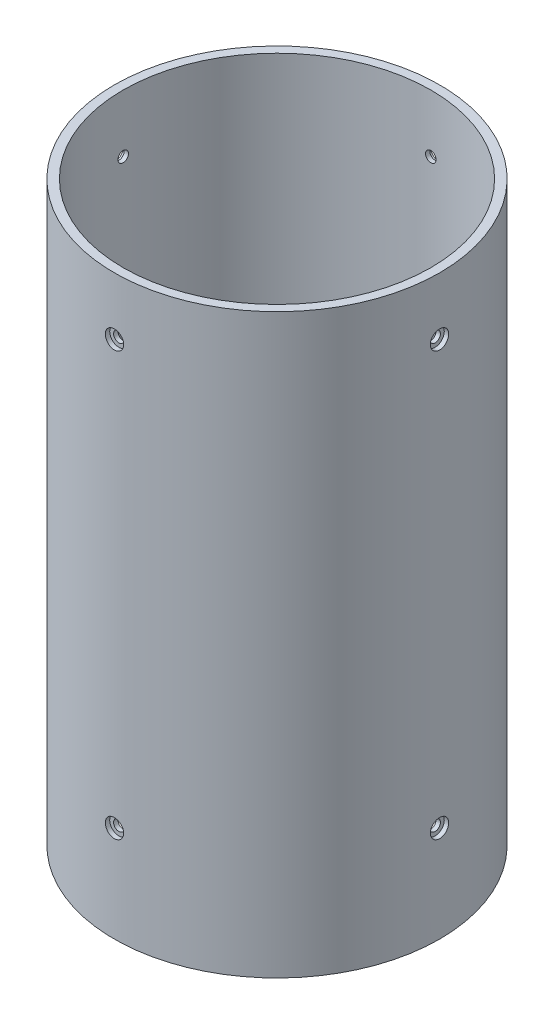
from build123d import *

# Parameters (mm, degrees)
SKETCH1_R                         = 53.721
SKETCH1_R_2                       = 50.8
BODY_EXTRUSION_DEPTH              = 190.5
UPPER_BULKHEAD_HOLES_REACH        = 227.211
SKETCH2_R                         = 1.7526
UPPER_BULKHEAD_HOLE_PATTERN_COUNT = 4
CUT_EXTRUDE1_REACH                = 227.211
SKETCH3_R                         = 1.7526
CIRPATTERN1_COUNT                 = 4
SKETCH4_R                         = 3.0226
COUNTERSINK_DEPTH                 = 1.524
CIRPATTERN2_COUNT                 = 4


with BuildPart() as part:
    # Sketch1 → Body Extrusion (new body)
    with BuildSketch(Plane(origin=(0, 0, 0), x_dir=(1, 0, 0), z_dir=(0, 1, 0))):
        Circle(SKETCH1_R)
        Circle(SKETCH1_R_2, mode=Mode.SUBTRACT)
    extrude(amount=BODY_EXTRUSION_DEPTH)

    # Sketch2 → Upper Bulkhead Holes (cut, up to next)
    with BuildSketch(Plane.XY.offset(53.721), mode=Mode.PRIVATE) as upper_bulkhead_holes_sk1:
        with Locations((0, 171.45)):
            Circle(SKETCH2_R)
    upper_bulkhead_holes_tool1 = extrude(upper_bulkhead_holes_sk1.sketch, amount=-UPPER_BULKHEAD_HOLES_REACH, mode=Mode.PRIVATE) & part.part
    upper_bulkhead_holes = upper_bulkhead_holes_tool1.solids().sort_by_distance((0, 171.45, 53.721))[0]
    add(upper_bulkhead_holes, mode=Mode.SUBTRACT)

    # Upper Bulkhead Hole Pattern: Upper Bulkhead Holes ×4 about axis
    upper_bulkhead_hole_pattern_axis = Axis((0, 190.5, 0), (0, -1, 0))
    for i in range(1, UPPER_BULKHEAD_HOLE_PATTERN_COUNT):
        add(upper_bulkhead_holes.rotate(upper_bulkhead_hole_pattern_axis, i * 360 / UPPER_BULKHEAD_HOLE_PATTERN_COUNT), mode=Mode.SUBTRACT)

    # Sketch3 → Cut-Extrude1 (cut, up to next)
    with BuildSketch(Plane.XY.offset(53.721), mode=Mode.PRIVATE) as cut_extrude1_sk1:
        with Locations((0, 31.75)):
            Circle(SKETCH3_R)
    cut_extrude1_tool1 = extrude(cut_extrude1_sk1.sketch, amount=-CUT_EXTRUDE1_REACH, mode=Mode.PRIVATE) & part.part
    cut_extrude1 = cut_extrude1_tool1.solids().sort_by_distance((0, 31.75, 53.721))[0]
    add(cut_extrude1, mode=Mode.SUBTRACT)

    # CirPattern1: Cut-Extrude1 ×4 about axis
    cirpattern1_axis = Axis((0, 190.5, 0), (0, -1, 0))
    for i in range(1, CIRPATTERN1_COUNT):
        add(cut_extrude1.rotate(cirpattern1_axis, i * 360 / CIRPATTERN1_COUNT), mode=Mode.SUBTRACT)

    # Sketch4 → Countersink (cut)
    with BuildSketch(Plane.XY.offset(53.721)):
        with Locations((0, 171.45)):
            Circle(SKETCH4_R)
        with Locations((0, 31.75)):
            Circle(SKETCH4_R)
    countersink = extrude(amount=-COUNTERSINK_DEPTH, mode=Mode.SUBTRACT)

    # CirPattern2: Countersink ×4 about axis
    cirpattern2_axis = Axis((0, 190.5, 0), (0, -1, 0))
    for i in range(1, CIRPATTERN2_COUNT):
        add(countersink.rotate(cirpattern2_axis, i * 360 / CIRPATTERN2_COUNT), mode=Mode.SUBTRACT)


solid = part.part
